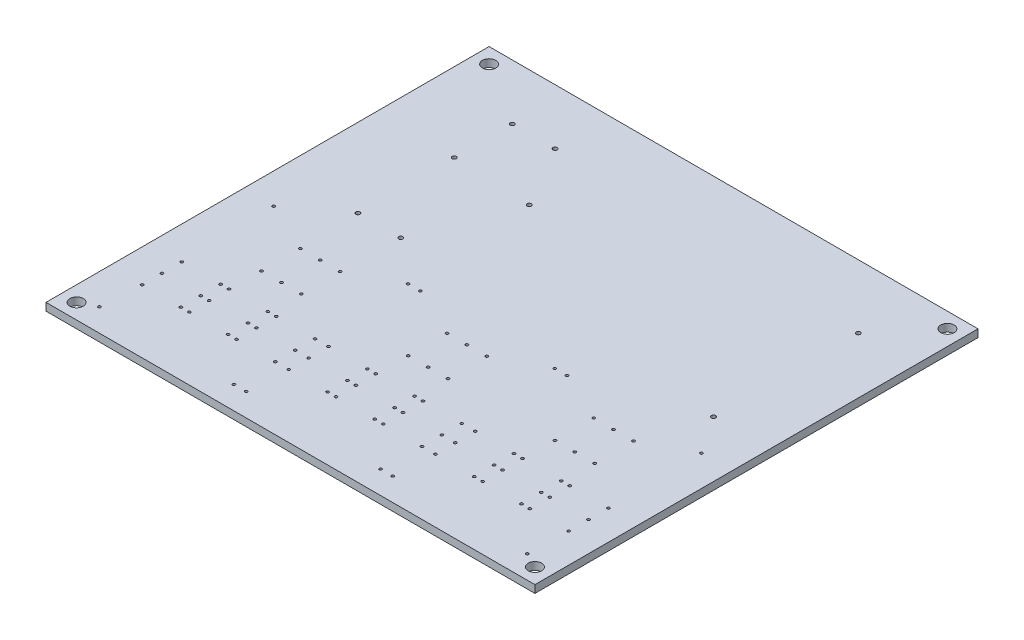
from build123d import *

# Parameters (mm, degrees)
SKETCH1_W                      = 406.4
SKETCH1_H                      = 6.35
BASE_FLANGE3_DEPTH             = 368.3
F_7_16_0_4375_DIAMETER_HOLE1_D = 11.1125
F_4_40_TAPPED_HOLE2_D          = 2.2606
LPATTERN1_COUNT                = 3
LPATTERN1_PITCH                = 16.51
F_4_40_TAPPED_HOLE3_D          = 2.2606
LPATTERN2_COUNT                = 3
LPATTERN2_PITCH                = 16.51
LPATTERN2_COUNT_DIR2           = 2
LPATTERN2_PITCH_DIR2           = 32.258
F_4_40_TAPPED_HOLE1_D          = 2.2606
LPATTERN3_COUNT                = 2
LPATTERN3_PITCH                = 111.76
LPATTERN3_COUNT_DIR2           = 2
LPATTERN3_PITCH_DIR2           = 144.78
F_8_32_TAPPED_HOLE2_D          = 3.4544
F_8_32_TAPPED_HOLE1_D          = 3.4544


# Sheet-metal steps are written as plain solids
with BuildPart() as part:
    # Sketch1 → Base-Flange3 (new body)
    with BuildSketch(Plane.XY):
        with Locations((203.2, 3.175)):
            Rectangle(SKETCH1_W, SKETCH1_H)
    extrude(amount=BASE_FLANGE3_DEPTH)

    # 7/16 (0.4375) Diameter Hole1 (through all)
    with Locations(Plane(origin=(0, 6.35, 0), x_dir=(1, 0, 0), z_dir=(0, 1, 0))):
        with Locations((12.7, -355.6), (393.7, -355.6), (393.7, -12.7), (12.7, -12.7)):
            Hole(F_7_16_0_4375_DIAMETER_HOLE1_D / 2)

    # #4-40 Tapped Hole2 (through all)
    with Locations(Plane(origin=(0, 6.35, 0), x_dir=(1, 0, 0), z_dir=(0, 1, 0))):
        with Locations((27.305, -282.702), (59.563, -282.702), (66.548, -282.702), (98.806, -282.702), (105.791, -282.702), (138.049, -282.702), (149.225, -282.702), (181.483, -282.702), (188.468, -282.702), (220.726, -282.702), (227.711, -282.702), (259.969, -282.702), (271.145, -282.702), (303.403, -282.702), (310.388, -282.702), (342.646, -282.702), (349.631, -282.702), (381.889, -282.702)):
            f_4_40_tapped_hole2 = Hole(F_4_40_TAPPED_HOLE2_D / 2)

    # LPattern1: #4-40 Tapped Hole2 ×3
    with Locations(*[(0, 0, i * LPATTERN1_PITCH) for i in range(1, LPATTERN1_COUNT)]):
        add(f_4_40_tapped_hole2, mode=Mode.SUBTRACT)

    # #4-40 Tapped Hole3 (through all)
    with Locations(Plane(origin=(0, 6.35, 0), x_dir=(1, 0, 0), z_dir=(0, 1, 0))):
        with Locations((67.056, -223.901), (188.976, -223.901), (310.896, -223.901)):
            f_4_40_tapped_hole3 = Hole(F_4_40_TAPPED_HOLE3_D / 2)

    # LPattern2: 4-40 Tapped Hole3 3 × 2
    with Locations(*[(i * LPATTERN2_PITCH, 0, j * LPATTERN2_PITCH_DIR2) for i in range(LPATTERN2_COUNT) for j in range(LPATTERN2_COUNT_DIR2) if (i, j) != (0, 0)]):
        add(f_4_40_tapped_hole3, mode=Mode.SUBTRACT)

    # #4-40 Tapped Hole1 (through all)
    with Locations(Plane(origin=(0, 6.35, 0), x_dir=(1, 0, 0), z_dir=(0, 1, 0))):
        with Locations((381, -349.25), (259.08, -349.25), (137.16, -349.25)):
            f_4_40_tapped_hole1 = Hole(F_4_40_TAPPED_HOLE1_D / 2)

    # LPattern3: 4-40 Tapped Hole1 2 × 2
    with Locations(*[(-i * LPATTERN3_PITCH, 0, -j * LPATTERN3_PITCH_DIR2) for i in range(LPATTERN3_COUNT) for j in range(LPATTERN3_COUNT_DIR2) if (i, j) != (0, 0)]):
        add(f_4_40_tapped_hole1, mode=Mode.SUBTRACT)

    # #8-32 Tapped Hole2 (through all)
    with Locations(Plane(origin=(0, 6.35, 0), x_dir=(1, 0, 0), z_dir=(0, 1, 0))):
        with Locations((359.736646422, -173.228), (359.736646422, -52.832), (130.687725552, -97.282)):
            Hole(F_8_32_TAPPED_HOLE2_D / 2)

    # #8-32 Tapped Hole1 (through all)
    with Locations(Plane(origin=(0, 6.35, 0), x_dir=(1, 0, 0), z_dir=(0, 1, 0))):
        with Locations((65.409725552, -46.1264), (100.969725552, -46.1264), (100.969725552, -174.3964), (65.409725552, -174.3964), (65.409725552, -94.3864)):
            Hole(F_8_32_TAPPED_HOLE1_D / 2)


solid = part.part
